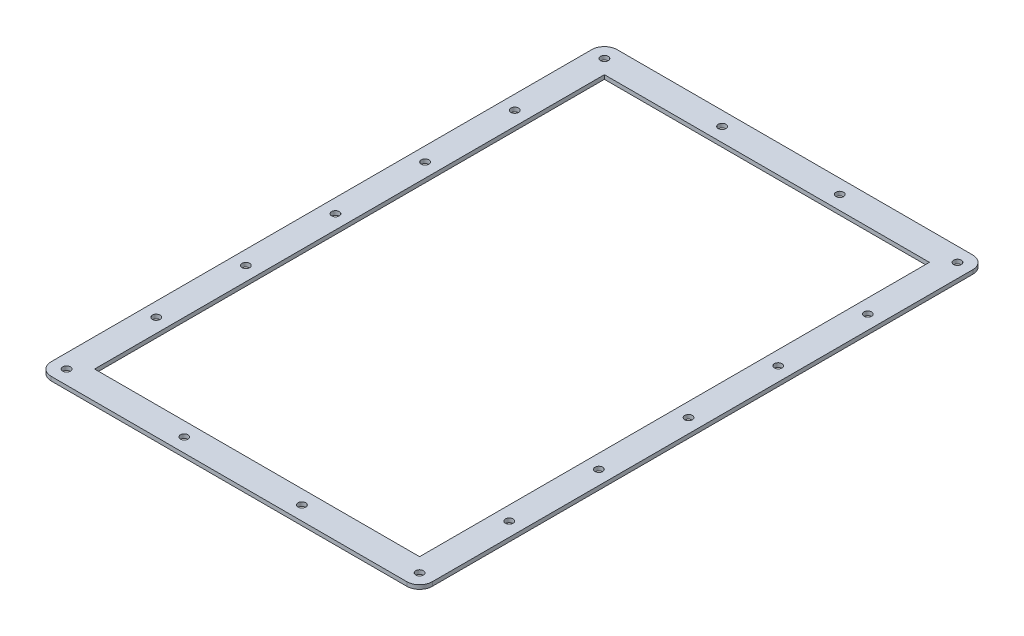
from build123d import *

# Parameters (mm, degrees)
SKETCH1_W           = 299
SKETCH1_H           = 444
SKETCH1_R           = 3
SKETCH1_W_2         = 255
SKETCH1_H_2         = 400
BOSS_EXTRUDE1_DEPTH = 3.175
FILLET1_R           = 10


with BuildPart() as part:
    # Sketch1 → Boss-Extrude1 (new body)
    with BuildSketch(Plane(origin=(0, 0, 0), x_dir=(1, 0, 0), z_dir=(0, 1, 0))):
        with Locations((2.5, -50)):
            Rectangle(SKETCH1_W, SKETCH1_H)
        with Locations((-136, -261)):
            Circle(SKETCH1_R, mode=Mode.SUBTRACT)
        with Locations((-136, -190.666666667)):
            Circle(SKETCH1_R, mode=Mode.SUBTRACT)
        with Locations((-43.666666667, -261)):
            Circle(SKETCH1_R, mode=Mode.SUBTRACT)
        with Locations((-136, -120.333333333)):
            Circle(SKETCH1_R, mode=Mode.SUBTRACT)
        with Locations((-136, -50)):
            Circle(SKETCH1_R, mode=Mode.SUBTRACT)
        with Locations((48.666666667, -261)):
            Circle(SKETCH1_R, mode=Mode.SUBTRACT)
        with Locations((141, -261)):
            Circle(SKETCH1_R, mode=Mode.SUBTRACT)
        with Locations((141, -190.666666667)):
            Circle(SKETCH1_R, mode=Mode.SUBTRACT)
        with Locations((141, -120.333333333)):
            Circle(SKETCH1_R, mode=Mode.SUBTRACT)
        with Locations((-136, 20.333333333)):
            Circle(SKETCH1_R, mode=Mode.SUBTRACT)
        with Locations((2.5, -50)):
            Rectangle(SKETCH1_W_2, SKETCH1_H_2, mode=Mode.SUBTRACT)
        with Locations((-136, 90.666666667)):
            Circle(SKETCH1_R, mode=Mode.SUBTRACT)
        with Locations((-136, 161)):
            Circle(SKETCH1_R, mode=Mode.SUBTRACT)
        with Locations((-43.666666667, 161)):
            Circle(SKETCH1_R, mode=Mode.SUBTRACT)
        with Locations((141, -50)):
            Circle(SKETCH1_R, mode=Mode.SUBTRACT)
        with Locations((141, 20.333333333)):
            Circle(SKETCH1_R, mode=Mode.SUBTRACT)
        with Locations((48.666666667, 161)):
            Circle(SKETCH1_R, mode=Mode.SUBTRACT)
        with Locations((141, 90.666666667)):
            Circle(SKETCH1_R, mode=Mode.SUBTRACT)
        with Locations((141, 161)):
            Circle(SKETCH1_R, mode=Mode.SUBTRACT)
    extrude(amount=BOSS_EXTRUDE1_DEPTH)

    # Fillet1
    fillet1_edges = [part.edges().sort_by_distance(p)[0] for p in [
        (152, 1.5875, 272),
        (-147, 1.5875, 272),
        (152, 1.5875, -172),
        (-147, 1.5875, -172),
    ]]
    fillet(fillet1_edges, radius=FILLET1_R)


solid = part.part
